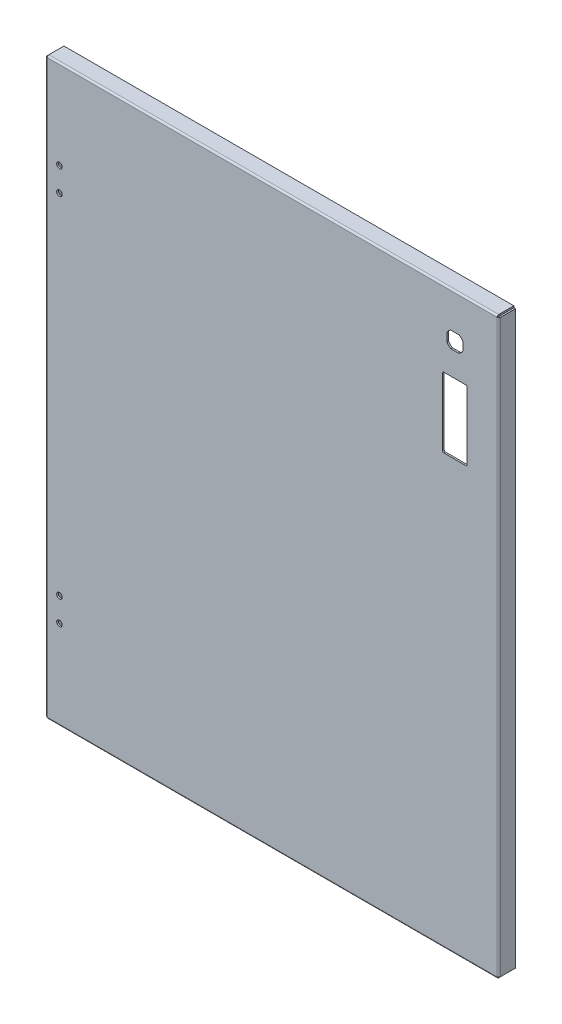
from build123d import *

# Parameters (mm, degrees)
SKIZZE1_W                          = 564
SKIZZE1_H                          = 715.9
BASIS_BLECH_DEPTH                  = 2
KANTE_LASCHE1_DEPTH                = 715.9
KANTE_LASCHE2_DEPTH                = 564
KANTE_LASCHE3_DEPTH                = 715.9
KANTE_LASCHE4_DEPTH                = 564
SCHNITT_LINEAR_AUSTRAGEN1_REACH    = 916.568
F_7_0_7_DURCHMESSER_BOHRUNG1_D     = 7
F_7_0_7_DURCHMESSER_BOHRUNG1_DEPTH = 20
F_7_0_7_DURCHMESSER_BOHRUNG1_TIP   = 2.103012167


# Sheet-metal steps are written as plain solids
with BuildPart() as part:
    # Skizze1 → Basis-Blech (new body)
    with BuildSketch(Plane.XY):
        with Locations((-282, 357.95)):
            Rectangle(SKIZZE1_W, SKIZZE1_H)
    extrude(amount=-BASIS_BLECH_DEPTH)

    # Kante-Lasche1 section (across the edge) → Kante-Lasche1 (add)
    with BuildSketch(Plane(origin=(0.1, 715.9, -2), x_dir=(-1, 0, 0), z_dir=(0, -1, 0))):
        with BuildLine():
            Line((-2, 0.1), (-2, 19))
            Line((-2, 19), (0, 19))
            Line((0, 19), (0, 0.1))
            ThreePointArc((0, 0.1), (0.029289322, 0.029289322), (0.1, 0))
            Line((0.1, 0), (0.1, -2))
            ThreePointArc((0.1, -2), (-1.38492424, -1.38492424), (-2, 0.1))
        make_face()
    extrude(amount=KANTE_LASCHE1_DEPTH)

    # Kante-Lasche2 section (across the edge) → Kante-Lasche2 (add)
    with BuildSketch(Plane(origin=(-564, 716, -2), x_dir=(0, -1, 0), z_dir=(1, 0, 0))):
        with BuildLine():
            Line((-2, 0.1), (-2, 19))
            Line((-2, 19), (0, 19))
            Line((0, 19), (0, 0.1))
            ThreePointArc((0, 0.1), (0.029289322, 0.029289322), (0.1, 0))
            Line((0.1, 0), (0.1, -2))
            ThreePointArc((0.1, -2), (-1.38492424, -1.38492424), (-2, 0.1))
        make_face()
    extrude(amount=KANTE_LASCHE2_DEPTH)

    # Kante-Lasche3 section (across the edge) → Kante-Lasche3 (add)
    with BuildSketch(Plane(origin=(-564.1, 0, -2), x_dir=(1, 0, 0), z_dir=(0, 1, 0))):
        with BuildLine():
            Line((-2, 0.1), (-2, 19))
            Line((-2, 19), (0, 19))
            Line((0, 19), (0, 0.1))
            ThreePointArc((0, 0.1), (0.029289322, 0.029289322), (0.1, 0))
            Line((0.1, 0), (0.1, -2))
            ThreePointArc((0.1, -2), (-1.38492424, -1.38492424), (-2, 0.1))
        make_face()
    extrude(amount=KANTE_LASCHE3_DEPTH)

    # Kante-Lasche4 section (across the edge) → Kante-Lasche4 (add)
    with BuildSketch(Plane(origin=(0, -0.1, -2), x_dir=(0, 1, 0), z_dir=(-1, 0, 0))):
        with BuildLine():
            Line((-2, 0.1), (-2, 19))
            Line((-2, 19), (0, 19))
            Line((0, 19), (0, 0.1))
            ThreePointArc((0, 0.1), (0.029289322, 0.029289322), (0.1, 0))
            Line((0.1, 0), (0.1, -2))
            ThreePointArc((0.1, -2), (-1.38492424, -1.38492424), (-2, 0.1))
        make_face()
    extrude(amount=KANTE_LASCHE4_DEPTH)

    # Skizze17 → Schnitt-Linear austragen1 (cut, up to next)
    with BuildSketch(Plane.XY, mode=Mode.PRIVATE) as schnitt_linear_austragen1_sk1:
        with BuildLine():
            Line((-62.95, 657.944310136), (-62.95, 668.055689864))
            ThreePointArc((-62.95, 668.055689864), (-60.854951288, 670.954951288), (-57.955689864, 673.05))
            Line((-57.955689864, 673.05), (-47.844310136, 673.05))
            ThreePointArc((-47.844310136, 673.05), (-44.945048712, 670.954951288), (-42.85, 668.055689864))
            Line((-42.85, 668.055689864), (-42.85, 657.944310136))
            ThreePointArc((-42.85, 657.944310136), (-44.945048712, 655.045048712), (-47.844310136, 652.95))
            Line((-47.844310136, 652.95), (-57.955689864, 652.95))
            ThreePointArc((-57.955689864, 652.95), (-60.854951288, 655.045048712), (-62.95, 657.944310136))
        make_face()
    schnitt_linear_austragen1_tool1 = extrude(schnitt_linear_austragen1_sk1.sketch, amount=-SCHNITT_LINEAR_AUSTRAGEN1_REACH, mode=Mode.PRIVATE) & part.part
    # Skizze17 → Schnitt-Linear austragen1 (cut, up to next)
    with BuildSketch(Plane.XY, mode=Mode.PRIVATE) as schnitt_linear_austragen1_sk2:
        with BuildLine():
            Line((-66.75, 623), (-39.05, 623))
            ThreePointArc((-39.05, 623), (-37.989339828, 622.560660172), (-37.55, 621.5))
            Line((-37.55, 621.5), (-37.55, 536.9))
            ThreePointArc((-37.55, 536.9), (-37.989339828, 535.839339828), (-39.05, 535.4))
            Line((-39.05, 535.4), (-66.75, 535.4))
            ThreePointArc((-66.75, 535.4), (-67.810660172, 535.839339828), (-68.25, 536.9))
            Line((-68.25, 536.9), (-68.25, 621.5))
            ThreePointArc((-68.25, 621.5), (-67.810660172, 622.560660172), (-66.75, 623))
        make_face()
    schnitt_linear_austragen1_tool2 = extrude(schnitt_linear_austragen1_sk2.sketch, amount=-SCHNITT_LINEAR_AUSTRAGEN1_REACH, mode=Mode.PRIVATE) & part.part
    add(schnitt_linear_austragen1_tool1.solids().sort_by_distance((-52.9, 663, 0))[0], mode=Mode.SUBTRACT)
    add(schnitt_linear_austragen1_tool2.solids().sort_by_distance((-52.9, 579.2, 0))[0], mode=Mode.SUBTRACT)

    # Ø7.0 (7) Durchmesser Bohrung1
    with Locations(Plane.XY):
        with Locations((-548.6, 109.4), (-548.6, 139.4), (-548.6, 576.5), (-548.6, 606.5)):
            Hole(F_7_0_7_DURCHMESSER_BOHRUNG1_D / 2, depth=F_7_0_7_DURCHMESSER_BOHRUNG1_DEPTH)
            with Locations((0, 0, -(F_7_0_7_DURCHMESSER_BOHRUNG1_DEPTH + F_7_0_7_DURCHMESSER_BOHRUNG1_TIP / 2))):  # 118° drill point
                Cone(0, F_7_0_7_DURCHMESSER_BOHRUNG1_D / 2, F_7_0_7_DURCHMESSER_BOHRUNG1_TIP, mode=Mode.SUBTRACT)


solid = part.part
